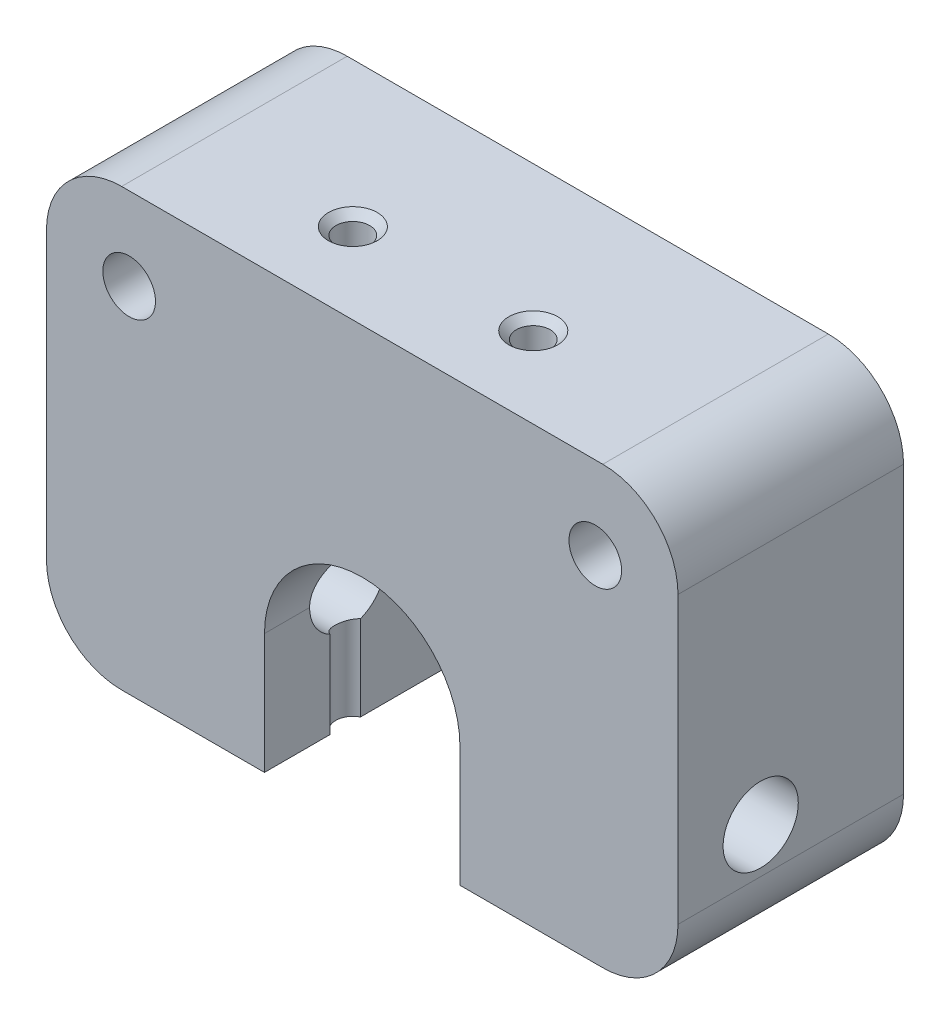
from build123d import *

# Parameters (mm, degrees)
SKETCH1_W           = 42
SKETCH1_H           = 29
BOSS_EXTRUDE1_DEPTH = 15
FILLET2_R           = 5
SKETCH2_R           = 1.75
CUT_EXTRUDE1_DEPTH  = 30.601520231
CUT_EXTRUDE2_DEPTH  = 30.601520231
SKETCH4_R           = 1.125
CUT_EXTRUDE3_DEPTH  = 39.820097888
CHAMFER1_SIZE       = 0.5
CHAMFER2_SIZE       = 0.5
SKETCH5_R           = 2.5
CUT_EXTRUDE4_DEPTH  = 47.896161953
CUT_EXTRUDE5_DEPTH  = 3


with BuildPart() as part:
    # Sketch1 → Boss-Extrude1 (new body)
    with BuildSketch(Plane.XY):
        Rectangle(SKETCH1_W, SKETCH1_H)
    extrude(amount=BOSS_EXTRUDE1_DEPTH)

    # Fillet2
    fillet2_edges = [part.edges().sort_by_distance(p)[0] for p in [
        (-21, -14.5, 7.5),
        (21, -14.5, 7.5),
        (21, 14.5, 7.5),
        (-21, 14.5, 7.5),
    ]]
    fillet(fillet2_edges, radius=FILLET2_R)

    # Sketch2 → Cut-Extrude1 (cut, through all)
    with BuildSketch(Plane.XY.offset(15)):
        with Locations((-15.5, 9)):
            Circle(SKETCH2_R)
        with Locations((15.5, 9)):
            Circle(SKETCH2_R)
    extrude(amount=-CUT_EXTRUDE1_DEPTH, mode=Mode.SUBTRACT)

    # Sketch3 → Cut-Extrude2 (cut, through all)
    with BuildSketch(Plane.XY.offset(15)):
        with BuildLine():
            Line((-6.5, -6.5), (-6.5, -14.5))
            Line((-6.5, -14.5), (6.5, -14.5))
            Line((6.5, -14.5), (6.5, -6.5))
            ThreePointArc((6.5, -6.5), (0, 0), (-6.5, -6.5))
        make_face()
    extrude(amount=-CUT_EXTRUDE2_DEPTH, mode=Mode.SUBTRACT)

    # Sketch4 → Cut-Extrude3 (cut, through all)
    with BuildSketch(Plane(origin=(0, 14.5, 0), x_dir=(-1, 0, 0), z_dir=(0, 1, 0))):
        with Locations((6, 9.625)):
            Circle(SKETCH4_R)
        with Locations((-6, 9.625)):
            Circle(SKETCH4_R)
    extrude(amount=-CUT_EXTRUDE3_DEPTH, mode=Mode.SUBTRACT)

    # Chamfer1
    chamfer1_edges = [part.edges().sort_by_distance(p)[0] for p in [
        (-4.875, 14.5, 9.625),
    ]]
    chamfer(chamfer1_edges, length=CHAMFER1_SIZE)

    # Chamfer2
    chamfer2_edges = [part.edges().sort_by_distance(p)[0] for p in [
        (7.125, 14.5, 9.625),
    ]]
    chamfer(chamfer2_edges, length=CHAMFER2_SIZE)

    # Sketch5 → Cut-Extrude4 (cut, through all)
    with BuildSketch(Plane(origin=(21, 0, 0), x_dir=(0, 0, -1), z_dir=(1, 0, 0))):
        with Locations((-9.5, -6.5)):
            Circle(SKETCH5_R)
    extrude(amount=-CUT_EXTRUDE4_DEPTH, mode=Mode.SUBTRACT)

    # Sketch6 → Cut-Extrude5 (cut)
    with BuildSketch(Plane(origin=(0, 0, 0), x_dir=(1, 0, 0), z_dir=(0, 0, -1))):
        with BuildLine():
            Line((-13.75, 6.5), (-13.75, 14.5))
            Line((-13.75, 14.5), (13.75, 14.5))
            Line((13.75, 14.5), (13.75, 6.5))
            ThreePointArc((13.75, 6.5), (0, -7.25), (-13.75, 6.5))
        make_face()
    extrude(amount=-CUT_EXTRUDE5_DEPTH, mode=Mode.SUBTRACT)


solid = part.part
